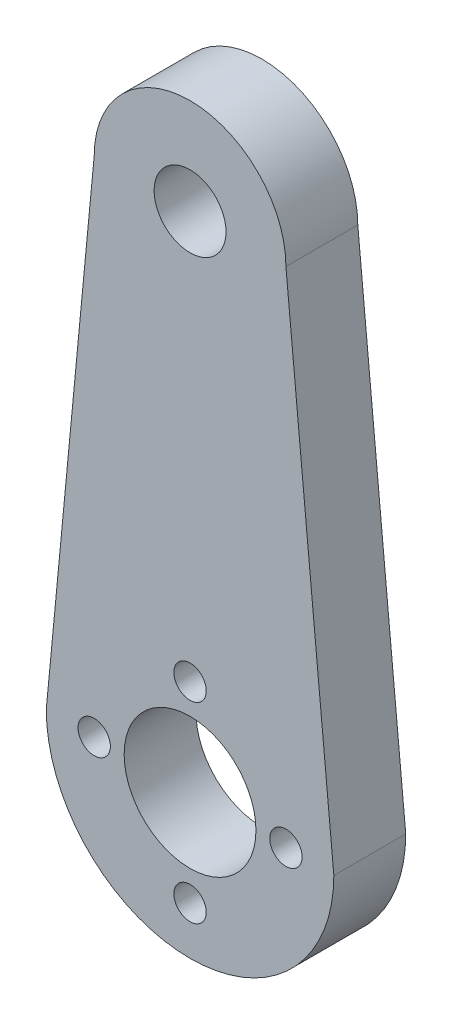
from build123d import *

# Parameters (mm, degrees)
BOSS_EXTRU_1_DEPTH           = 6
ENL_V_MAT_EXTRU_1_DEPTH      = 52.768716422
ENL_V_MAT_EXTRU_1_DEPTH_BACK = 52.768716422
ESQUISSE2_R                  = 5.5
ESQUISSE2_R_2                = 1.35
ESQUISSE2_R_3                = 3


with BuildPart() as part:
    # Esquisse1 → Boss.-Extru.1 (new body)
    with BuildSketch(Plane.XY):
        with BuildLine():
            Line((12, 0), (8, 42))
            ThreePointArc((8, 42), (0, 50), (-8, 42))
            Line((-8, 42), (-12, 0))
            ThreePointArc((-12, 0), (0, -12), (12, 0))
        make_face()
    extrude(amount=BOSS_EXTRU_1_DEPTH)

    # Esquisse2 → Enlèv. mat.-Extru.1 (cut, two sides: drawn at the far end of the back side and taken through both)
    with BuildSketch(Plane.XY.offset(6).offset(-ENL_V_MAT_EXTRU_1_DEPTH_BACK)):
        Circle(ESQUISSE2_R)
        with Locations((8, 0)):
            Circle(ESQUISSE2_R_2)
        with Locations((0, -8)):
            Circle(ESQUISSE2_R_2)
        with Locations((-8, 0)):
            Circle(ESQUISSE2_R_2)
        with Locations((0, 8)):
            Circle(ESQUISSE2_R_2)
        with Locations((0, 42)):
            Circle(ESQUISSE2_R_3)
    extrude(amount=ENL_V_MAT_EXTRU_1_DEPTH + ENL_V_MAT_EXTRU_1_DEPTH_BACK, mode=Mode.SUBTRACT)


solid = part.part
